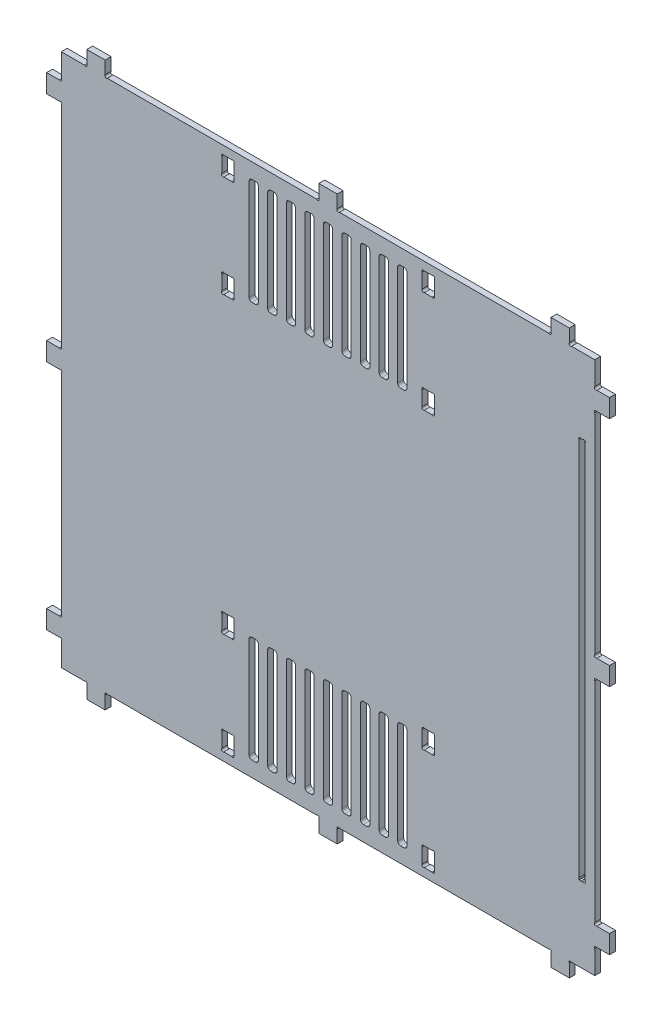
from build123d import *

# Parameters (mm, degrees)
BOSS_EXTRUDE1_DEPTH = 3.175
SKETCH2_W           = 3.302
SKETCH2_H           = 206.35
CUT_EXTRUDE1_DEPTH  = 418.540948216
SKETCH4_W           = 7.43030637
SKETCH4_H           = 0.0508
SKETCH4_W_2         = 0.0508
SKETCH4_H_2         = 7.253496569
SKETCH4_W_3         = 7.253496569
SKETCH4_H_3         = 7.43030637
CUT_EXTRUDE2_DEPTH  = 418.540948216
CUT_EXTRUDE4_DEPTH  = 418.540948216


# Read off the part's stored shape, not the designer's step: Boss-Extrude1
with BuildPart() as part:
    # Boss-Extrude1 outline → Boss-Extrude1 (new body)
    with BuildSketch(Plane.XY):
        with BuildLine():
            Line((13.65, 295.2375), (13.65, 288.422532015))
            ThreePointArc((13.65, 288.422532015), (13.65, 287.3), (12.527467985, 287.3))
            Line((12.527467985, 287.3), (0, 287.3))
            Line((0, 287.3), (0, 274.772532015))
            ThreePointArc((0, 274.772532015), (0, 273.65), (-1.122532015, 273.65))
            Line((-1.122532015, 273.65), (-7.9375, 273.65))
            Line((-7.9375, 273.65), (-7.9375, 263.65))
            Line((-7.9375, 263.65), (-1.122532015, 263.65))
            ThreePointArc((-1.122532015, 263.65), (0, 263.65), (0, 262.527467985))
            Line((0, 262.527467985), (0, 149.772532015))
            ThreePointArc((0, 149.772532015), (0, 148.65), (-1.122532015, 148.65))
            Line((-1.122532015, 148.65), (-7.9375, 148.65))
            Line((-7.9375, 148.65), (-7.9375, 138.65))
            Line((-7.9375, 138.65), (-1.122532015, 138.65))
            ThreePointArc((-1.122532015, 138.65), (0, 138.65), (0, 137.527467985))
            Line((0, 137.527467985), (0, 24.772532015))
            ThreePointArc((0, 24.772532015), (0, 23.65), (-1.122532015, 23.65))
            Line((-1.122532015, 23.65), (-7.9375, 23.65))
            Line((-7.9375, 23.65), (-7.9375, 13.65))
            Line((-7.9375, 13.65), (-1.122532015, 13.65))
            ThreePointArc((-1.122532015, 13.65), (0, 13.65), (0, 12.527467985))
            Line((0, 12.527467985), (0, 0))
            Line((0, 0), (12.527467985, 0))
            ThreePointArc((12.527467985, 0), (13.65, 0), (13.65, -1.122532015))
            Line((13.65, -1.122532015), (13.65, -7.9375))
            Line((13.65, -7.9375), (23.65, -7.9375))
            Line((23.65, -7.9375), (23.65, -1.122532015))
            ThreePointArc((23.65, -1.122532015), (23.65, 0), (24.772532015, 0))
            Line((24.772532015, 0), (137.527467985, 0))
            ThreePointArc((137.527467985, 0), (138.65, 0), (138.65, -1.122532015))
            Line((138.65, -1.122532015), (138.65, -7.9375))
            Line((138.65, -7.9375), (148.65, -7.9375))
            Line((148.65, -7.9375), (148.65, -1.122532015))
            ThreePointArc((148.65, -1.122532015), (148.65, 0), (149.772532015, 0))
            Line((149.772532015, 0), (262.527467985, 0))
            ThreePointArc((262.527467985, 0), (263.65, 0), (263.65, -1.122532015))
            Line((263.65, -1.122532015), (263.65, -7.9375))
            Line((263.65, -7.9375), (273.65, -7.9375))
            Line((273.65, -7.9375), (273.65, -1.122532015))
            ThreePointArc((273.65, -1.122532015), (273.65, 0), (274.772532015, 0))
            Line((274.772532015, 0), (287.3, 0))
            Line((287.3, 0), (287.3, 12.527467985))
            ThreePointArc((287.3, 12.527467985), (287.3, 13.65), (288.422532015, 13.65))
            Line((288.422532015, 13.65), (295.2375, 13.65))
            Line((295.2375, 13.65), (295.2375, 23.65))
            Line((295.2375, 23.65), (288.422532015, 23.65))
            ThreePointArc((288.422532015, 23.65), (287.3, 23.65), (287.3, 24.772532015))
            Line((287.3, 24.772532015), (287.3, 137.527467985))
            ThreePointArc((287.3, 137.527467985), (287.3, 138.65), (288.422532015, 138.65))
            Line((288.422532015, 138.65), (295.2375, 138.65))
            Line((295.2375, 138.65), (295.2375, 148.65))
            Line((295.2375, 148.65), (288.422532015, 148.65))
            ThreePointArc((288.422532015, 148.65), (287.3, 148.65), (287.3, 149.772532015))
            Line((287.3, 149.772532015), (287.3, 262.527467985))
            ThreePointArc((287.3, 262.527467985), (287.3, 263.65), (288.422532015, 263.65))
            Line((288.422532015, 263.65), (295.2375, 263.65))
            Line((295.2375, 263.65), (295.2375, 273.65))
            Line((295.2375, 273.65), (288.422532015, 273.65))
            ThreePointArc((288.422532015, 273.65), (287.3, 273.65), (287.3, 274.772532015))
            Line((287.3, 274.772532015), (287.3, 287.3))
            Line((287.3, 287.3), (274.772532015, 287.3))
            ThreePointArc((274.772532015, 287.3), (273.65, 287.3), (273.65, 288.422532015))
            Line((273.65, 288.422532015), (273.65, 295.2375))
            Line((273.65, 295.2375), (263.65, 295.2375))
            Line((263.65, 295.2375), (263.65, 288.422532015))
            ThreePointArc((263.65, 288.422532015), (263.65, 287.3), (262.527467985, 287.3))
            Line((262.527467985, 287.3), (149.772532015, 287.3))
            ThreePointArc((149.772532015, 287.3), (148.65, 287.3), (148.65, 288.422532015))
            Line((148.65, 288.422532015), (148.65, 295.2375))
            Line((148.65, 295.2375), (138.65, 295.2375))
            Line((138.65, 295.2375), (138.65, 288.422532015))
            ThreePointArc((138.65, 288.422532015), (138.65, 287.3), (137.527467985, 287.3))
            Line((137.527467985, 287.3), (24.772532015, 287.3))
            ThreePointArc((24.772532015, 287.3), (23.65, 287.3), (23.65, 288.422532015))
            Line((23.65, 288.422532015), (23.65, 295.2375))
            Line((23.65, 295.2375), (13.65, 295.2375))
        make_face()
        with BuildLine():
            Line((92.836997861, 13.451559456), (92.836997861, 5.696623486))
            ThreePointArc((92.836997861, 5.696623486), (92.836997861, 4.574091471), (91.714465846, 4.574091471))
            Line((91.714465846, 4.574091471), (87.609529876, 4.574091471))
            ThreePointArc((87.609529876, 4.574091471), (86.486997861, 4.574091471), (86.486997861, 5.696623486))
            Line((86.486997861, 5.696623486), (86.486997861, 13.451559456))
            ThreePointArc((86.486997861, 13.451559456), (86.486997861, 14.574091471), (87.609529876, 14.574091471))
            Line((87.609529876, 14.574091471), (91.714465846, 14.574091471))
            ThreePointArc((91.714465846, 14.574091471), (92.836997861, 14.574091471), (92.836997861, 13.451559456))
        make_face(mode=Mode.SUBTRACT)
        with BuildLine():
            Line((104.549498838, 8.25090853), (102.724498838, 8.25090853))
            ThreePointArc((102.724498838, 8.25090853), (101.601966823, 8.715876514), (101.136998838, 9.83840853))
            Line((101.136998838, 9.83840853), (101.136998838, 63.97740853))
            ThreePointArc((101.136998838, 63.97740853), (101.601966823, 65.099940546), (102.724498838, 65.56490853))
            Line((102.724498838, 65.56490853), (104.549498838, 65.56490853))
            ThreePointArc((104.549498838, 65.56490853), (105.672030853, 65.099940545), (106.136998838, 63.97740853))
            Line((106.136998838, 63.97740853), (106.136998838, 9.83840853))
            ThreePointArc((106.136998838, 9.83840853), (105.672030853, 8.715876515), (104.549498838, 8.25090853))
        make_face(mode=Mode.SUBTRACT)
        with BuildLine():
            Line((91.714465846, 59.438091471), (87.609529876, 59.438091471))
            ThreePointArc((87.609529876, 59.438091471), (86.486997861, 59.438091471), (86.486997861, 60.560623486))
            Line((86.486997861, 60.560623486), (86.486997861, 68.315559456))
            ThreePointArc((86.486997861, 68.315559456), (86.486997861, 69.438091471), (87.609529876, 69.438091471))
            Line((87.609529876, 69.438091471), (91.714465846, 69.438091471))
            ThreePointArc((91.714465846, 69.438091471), (92.836997861, 69.438091471), (92.836997861, 68.315559456))
            Line((92.836997861, 68.315559456), (92.836997861, 60.560623486))
            ThreePointArc((92.836997861, 60.560623486), (92.836997861, 59.438091471), (91.714465846, 59.438091471))
        make_face(mode=Mode.SUBTRACT)
        with BuildLine():
            Line((114.549498838, 8.25090853), (112.724498838, 8.25090853))
            ThreePointArc((112.724498838, 8.25090853), (111.601966823, 8.715876514), (111.136998838, 9.83840853))
            Line((111.136998838, 9.83840853), (111.136998838, 63.97740853))
            ThreePointArc((111.136998838, 63.97740853), (111.601966823, 65.099940546), (112.724498838, 65.56490853))
            Line((112.724498838, 65.56490853), (114.549498838, 65.56490853))
            ThreePointArc((114.549498838, 65.56490853), (115.672030853, 65.099940545), (116.136998838, 63.97740853))
            Line((116.136998838, 63.97740853), (116.136998838, 9.83840853))
            ThreePointArc((116.136998838, 9.83840853), (115.672030853, 8.715876515), (114.549498838, 8.25090853))
        make_face(mode=Mode.SUBTRACT)
        with BuildLine():
            Line((124.549498838, 8.25090853), (122.724498838, 8.25090853))
            ThreePointArc((122.724498838, 8.25090853), (121.601966823, 8.715876514), (121.136998838, 9.83840853))
            Line((121.136998838, 9.83840853), (121.136998838, 63.97740853))
            ThreePointArc((121.136998838, 63.97740853), (121.601966823, 65.099940546), (122.724498838, 65.56490853))
            Line((122.724498838, 65.56490853), (124.549498838, 65.56490853))
            ThreePointArc((124.549498838, 65.56490853), (125.672030853, 65.099940545), (126.136998838, 63.97740853))
            Line((126.136998838, 63.97740853), (126.136998838, 9.83840853))
            ThreePointArc((126.136998838, 9.83840853), (125.672030853, 8.715876515), (124.549498838, 8.25090853))
        make_face(mode=Mode.SUBTRACT)
        with BuildLine():
            Line((131.136998838, 9.83840853), (131.136998838, 63.97740853))
            ThreePointArc((131.136998838, 63.97740853), (131.601966823, 65.099940545), (132.724498838, 65.56490853))
            Line((132.724498838, 65.56490853), (134.549498838, 65.56490853))
            ThreePointArc((134.549498838, 65.56490853), (135.672030853, 65.099940545), (136.136998838, 63.97740853))
            Line((136.136998838, 63.97740853), (136.136998838, 9.83840853))
            ThreePointArc((136.136998838, 9.83840853), (135.672030853, 8.715876515), (134.549498838, 8.25090853))
            Line((134.549498838, 8.25090853), (132.724498838, 8.25090853))
            ThreePointArc((132.724498838, 8.25090853), (131.601966823, 8.715876515), (131.136998838, 9.83840853))
        make_face(mode=Mode.SUBTRACT)
        with BuildLine():
            Line((144.549498838, 8.25090853), (142.724498838, 8.25090853))
            ThreePointArc((142.724498838, 8.25090853), (141.601966823, 8.715876515), (141.136998838, 9.83840853))
            Line((141.136998838, 9.83840853), (141.136998838, 63.97740853))
            ThreePointArc((141.136998838, 63.97740853), (141.601966823, 65.099940545), (142.724498838, 65.56490853))
            Line((142.724498838, 65.56490853), (144.549498838, 65.56490853))
            ThreePointArc((144.549498838, 65.56490853), (145.672030853, 65.099940545), (146.136998838, 63.97740853))
            Line((146.136998838, 63.97740853), (146.136998838, 9.83840853))
            ThreePointArc((146.136998838, 9.83840853), (145.672030853, 8.715876515), (144.549498838, 8.25090853))
        make_face(mode=Mode.SUBTRACT)
        with BuildLine():
            Line((194.436999814, 5.666542396), (194.436999814, 13.421478365))
            ThreePointArc((194.436999814, 13.421478365), (194.436999814, 14.54401038), (195.559531829, 14.54401038))
            Line((195.559531829, 14.54401038), (199.664467799, 14.54401038))
            ThreePointArc((199.664467799, 14.54401038), (200.786999814, 14.54401038), (200.786999814, 13.421478365))
            Line((200.786999814, 13.421478365), (200.786999814, 5.666542396))
            ThreePointArc((200.786999814, 5.666542396), (200.786999814, 4.54401038), (199.664467799, 4.54401038))
            Line((199.664467799, 4.54401038), (195.559531829, 4.54401038))
            ThreePointArc((195.559531829, 4.54401038), (194.436999814, 4.54401038), (194.436999814, 5.666542396))
        make_face(mode=Mode.SUBTRACT)
        with BuildLine():
            Line((151.136998838, 9.83840853), (151.136998838, 63.97740853))
            ThreePointArc((151.136998838, 63.97740853), (151.601966823, 65.099940545), (152.724498838, 65.56490853))
            Line((152.724498838, 65.56490853), (154.549498838, 65.56490853))
            ThreePointArc((154.549498838, 65.56490853), (155.672030853, 65.099940545), (156.136998838, 63.97740853))
            Line((156.136998838, 63.97740853), (156.136998838, 9.83840853))
            ThreePointArc((156.136998838, 9.83840853), (155.672030853, 8.715876515), (154.549498838, 8.25090853))
            Line((154.549498838, 8.25090853), (152.724498838, 8.25090853))
            ThreePointArc((152.724498838, 8.25090853), (151.601966823, 8.715876515), (151.136998838, 9.83840853))
        make_face(mode=Mode.SUBTRACT)
        with BuildLine():
            Line((164.549498838, 8.25090853), (162.724498838, 8.25090853))
            ThreePointArc((162.724498838, 8.25090853), (161.601966823, 8.715876515), (161.136998838, 9.83840853))
            Line((161.136998838, 9.83840853), (161.136998838, 63.97740853))
            ThreePointArc((161.136998838, 63.97740853), (161.602585269, 65.100558652), (162.726247588, 65.564907567))
            Line((162.726247588, 65.564907567), (164.549497999, 65.56490853))
            ThreePointArc((164.549497999, 65.56490853), (165.672030556, 65.099940842), (166.136998838, 63.97740853))
            Line((166.136998838, 63.97740853), (166.136998838, 9.83840853))
            ThreePointArc((166.136998838, 9.83840853), (165.672030853, 8.715876515), (164.549498838, 8.25090853))
        make_face(mode=Mode.SUBTRACT)
        with BuildLine():
            Line((171.136998838, 9.83840853), (171.136998838, 63.97740853))
            ThreePointArc((171.136998838, 63.97740853), (171.601966823, 65.099940545), (172.724498838, 65.56490853))
            Line((172.724498838, 65.56490853), (174.549498838, 65.56490853))
            ThreePointArc((174.549498838, 65.56490853), (175.672030853, 65.099940545), (176.136998838, 63.97740853))
            Line((176.136998838, 63.97740853), (176.136998838, 9.83840853))
            ThreePointArc((176.136998838, 9.83840853), (175.672030853, 8.715876515), (174.549498838, 8.25090853))
            Line((174.549498838, 8.25090853), (172.724498838, 8.25090853))
            ThreePointArc((172.724498838, 8.25090853), (171.601966823, 8.715876515), (171.136998838, 9.83840853))
        make_face(mode=Mode.SUBTRACT)
        with BuildLine():
            Line((184.549498838, 8.25090853), (182.724498838, 8.25090853))
            ThreePointArc((182.724498838, 8.25090853), (181.601966823, 8.715876515), (181.136998838, 9.83840853))
            Line((181.136998838, 9.83840853), (181.136998838, 63.97740853))
            ThreePointArc((181.136998838, 63.97740853), (181.601966823, 65.099940545), (182.724498838, 65.56490853))
            Line((182.724498838, 65.56490853), (184.549498838, 65.56490853))
            ThreePointArc((184.549498838, 65.56490853), (185.672030853, 65.099940545), (186.136998838, 63.97740853))
            Line((186.136998838, 63.97740853), (186.136998838, 9.83840853))
            ThreePointArc((186.136998838, 9.83840853), (185.672030853, 8.715876515), (184.549498838, 8.25090853))
        make_face(mode=Mode.SUBTRACT)
        with BuildLine():
            Line((195.559531829, 69.40801038), (199.664467799, 69.40801038))
            ThreePointArc((199.664467799, 69.40801038), (200.786999814, 69.40801038), (200.786999814, 68.285478365))
            Line((200.786999814, 68.285478365), (200.786999814, 60.530542396))
            ThreePointArc((200.786999814, 60.530542396), (200.786999814, 59.40801038), (199.664467799, 59.40801038))
            Line((199.664467799, 59.40801038), (195.559531829, 59.40801038))
            ThreePointArc((195.559531829, 59.40801038), (194.436999814, 59.40801038), (194.436999814, 60.530542396))
            Line((194.436999814, 60.530542396), (194.436999814, 68.285478365))
            ThreePointArc((194.436999814, 68.285478365), (194.436999814, 69.40801038), (195.559531829, 69.40801038))
        make_face(mode=Mode.SUBTRACT)
        with BuildLine():
            Line((280.930799481, 40.475), (280.000863511, 40.475))
            ThreePointArc((280.000863511, 40.475), (278.878331496, 40.475), (278.878331496, 41.597532015))
            Line((278.878331496, 41.597532015), (278.878331496, 245.702467985))
            ThreePointArc((278.878331496, 245.702467985), (278.878331496, 246.825), (280.000863511, 246.825))
            Line((280.000863511, 246.825), (280.930799481, 246.825))
            ThreePointArc((280.930799481, 246.825), (282.053331496, 246.825), (282.053331496, 245.702467985))
            Line((282.053331496, 245.702467985), (282.053331496, 41.597532015))
            ThreePointArc((282.053331496, 41.597532015), (282.053331496, 40.475), (280.930799481, 40.475))
        make_face(mode=Mode.SUBTRACT)
        with BuildLine():
            Line((86.486997861, 218.984440544), (86.486997861, 226.739376514))
            ThreePointArc((86.486997861, 226.739376514), (86.486997861, 227.861908529), (87.609529876, 227.861908529))
            Line((87.609529876, 227.861908529), (91.714465846, 227.861908529))
            ThreePointArc((91.714465846, 227.861908529), (92.836997861, 227.861908529), (92.836997861, 226.739376514))
            Line((92.836997861, 226.739376514), (92.836997861, 218.984440544))
            ThreePointArc((92.836997861, 218.984440544), (92.836997861, 217.861908529), (91.714465846, 217.861908529))
            Line((91.714465846, 217.861908529), (87.609529876, 217.861908529))
            ThreePointArc((87.609529876, 217.861908529), (86.486997861, 217.861908529), (86.486997861, 218.984440544))
        make_face(mode=Mode.SUBTRACT)
        with BuildLine():
            Line((101.136998838, 223.32259147), (101.136998838, 277.461591202))
            ThreePointArc((101.136998838, 277.461591202), (101.601966806, 278.584123312), (102.724498838, 279.04909147))
            Line((102.724498838, 279.04909147), (104.549498838, 279.04909147))
            ThreePointArc((104.549498838, 279.04909147), (105.672030853, 278.584123485), (106.136998838, 277.46159147))
            Line((106.136998838, 277.46159147), (106.136998838, 223.32259147))
            ThreePointArc((106.136998838, 223.32259147), (105.672030853, 222.200059455), (104.549498838, 221.73509147))
            Line((104.549498838, 221.73509147), (102.724498838, 221.73509147))
            ThreePointArc((102.724498838, 221.73509147), (101.601966823, 222.200059454), (101.136998838, 223.32259147))
        make_face(mode=Mode.SUBTRACT)
        with BuildLine():
            Line((111.136998838, 223.32259147), (111.136998838, 277.46159147))
            ThreePointArc((111.136998838, 277.46159147), (111.601966822, 278.584123486), (112.724498838, 279.04909147))
            Line((112.724498838, 279.04909147), (114.549498838, 279.04909147))
            ThreePointArc((114.549498838, 279.04909147), (115.672030853, 278.584123485), (116.136998838, 277.46159147))
            Line((116.136998838, 277.46159147), (116.136998838, 223.32259147))
            ThreePointArc((116.136998838, 223.32259147), (115.672030853, 222.200059455), (114.549498838, 221.73509147))
            Line((114.549498838, 221.73509147), (112.724498838, 221.73509147))
            ThreePointArc((112.724498838, 221.73509147), (111.601966823, 222.200059454), (111.136998838, 223.32259147))
        make_face(mode=Mode.SUBTRACT)
        with BuildLine():
            Line((121.136998838, 223.32259147), (121.136998838, 277.46159147))
            ThreePointArc((121.136998838, 277.46159147), (121.601966822, 278.584123486), (122.724498838, 279.04909147))
            Line((122.724498838, 279.04909147), (124.549498838, 279.04909147))
            ThreePointArc((124.549498838, 279.04909147), (125.672030853, 278.584123485), (126.136998838, 277.46159147))
            Line((126.136998838, 277.46159147), (126.136998838, 223.32259147))
            ThreePointArc((126.136998838, 223.32259147), (125.672030853, 222.200059455), (124.549498838, 221.73509147))
            Line((124.549498838, 221.73509147), (122.724498838, 221.73509147))
            ThreePointArc((122.724498838, 221.73509147), (121.601966823, 222.200059454), (121.136998838, 223.32259147))
        make_face(mode=Mode.SUBTRACT)
        with BuildLine():
            Line((134.549498838, 221.73509147), (132.724498838, 221.73509147))
            ThreePointArc((132.724498838, 221.73509147), (131.601966823, 222.200059455), (131.136998838, 223.32259147))
            Line((131.136998838, 223.32259147), (131.136998838, 277.46159147))
            ThreePointArc((131.136998838, 277.46159147), (131.601966822, 278.584123486), (132.724498838, 279.04909147))
            Line((132.724498838, 279.04909147), (134.549498838, 279.04909147))
            ThreePointArc((134.549498838, 279.04909147), (135.672030853, 278.584123485), (136.136998838, 277.46159147))
            Line((136.136998838, 277.46159147), (136.136998838, 223.32259147))
            ThreePointArc((136.136998838, 223.32259147), (135.672030853, 222.200059455), (134.549498838, 221.73509147))
        make_face(mode=Mode.SUBTRACT)
        with BuildLine():
            Line((141.136998838, 223.32259147), (141.136998838, 277.46159147))
            ThreePointArc((141.136998838, 277.46159147), (141.601966822, 278.584123486), (142.724498838, 279.04909147))
            Line((142.724498838, 279.04909147), (144.549498838, 279.04909147))
            ThreePointArc((144.549498838, 279.04909147), (145.672030853, 278.584123485), (146.136998838, 277.46159147))
            Line((146.136998838, 277.46159147), (146.136998838, 223.32259147))
            ThreePointArc((146.136998838, 223.32259147), (145.672030853, 222.200059455), (144.549498838, 221.73509147))
            Line((144.549498838, 221.73509147), (142.724498838, 221.73509147))
            ThreePointArc((142.724498838, 221.73509147), (141.601966823, 222.200059455), (141.136998838, 223.32259147))
        make_face(mode=Mode.SUBTRACT)
        with BuildLine():
            Line((87.609529876, 282.725908529), (91.714465846, 282.725908529))
            ThreePointArc((91.714465846, 282.725908529), (92.836997861, 282.725908529), (92.836997861, 281.603376514))
            Line((92.836997861, 281.603376514), (92.836997861, 273.848440544))
            ThreePointArc((92.836997861, 273.848440544), (92.836997861, 272.725908529), (91.714465846, 272.725908529))
            Line((91.714465846, 272.725908529), (87.609529876, 272.725908529))
            ThreePointArc((87.609529876, 272.725908529), (86.486997861, 272.725908529), (86.486997861, 273.848440544))
            Line((86.486997861, 273.848440544), (86.486997861, 281.603376514))
            ThreePointArc((86.486997861, 281.603376514), (86.486997861, 282.725908529), (87.609529876, 282.725908529))
        make_face(mode=Mode.SUBTRACT)
        with BuildLine():
            Line((154.549498838, 221.73509147), (152.724498838, 221.73509147))
            ThreePointArc((152.724498838, 221.73509147), (151.601966823, 222.200059455), (151.136998838, 223.32259147))
            Line((151.136998838, 223.32259147), (151.136998838, 277.46159147))
            ThreePointArc((151.136998838, 277.46159147), (151.601966822, 278.584123486), (152.724498838, 279.04909147))
            Line((152.724498838, 279.04909147), (154.549498838, 279.04909147))
            ThreePointArc((154.549498838, 279.04909147), (155.672030853, 278.584123485), (156.136998838, 277.46159147))
            Line((156.136998838, 277.46159147), (156.136998838, 223.32259147))
            ThreePointArc((156.136998838, 223.32259147), (155.672030853, 222.200059455), (154.549498838, 221.73509147))
        make_face(mode=Mode.SUBTRACT)
        with BuildLine():
            Line((161.136998838, 223.32259147), (161.136998838, 277.461591202))
            ThreePointArc((161.136998838, 277.461591202), (161.601966806, 278.584123312), (162.724498838, 279.04909147))
            Line((162.724498838, 279.04909147), (164.549498838, 279.04909147))
            ThreePointArc((164.549498838, 279.04909147), (165.672030712, 278.584123144), (166.136998356, 277.461590988))
            Line((166.136998356, 277.461590988), (166.136998356, 223.322590988))
            ThreePointArc((166.136998356, 223.322590988), (165.672030372, 222.200058972), (164.549498356, 221.735090988))
            Line((164.549498356, 221.735090988), (162.724497517, 221.735091952))
            ThreePointArc((162.724497517, 221.735091952), (161.601966385, 222.200060092), (161.136998838, 223.32259147))
        make_face(mode=Mode.SUBTRACT)
        with BuildLine():
            Line((174.549498838, 221.73509147), (172.724498838, 221.73509147))
            ThreePointArc((172.724498838, 221.73509147), (171.601966823, 222.200059455), (171.136998838, 223.32259147))
            Line((171.136998838, 223.32259147), (171.136998838, 277.46159147))
            ThreePointArc((171.136998838, 277.46159147), (171.601966822, 278.584123486), (172.724498838, 279.04909147))
            Line((172.724498838, 279.04909147), (174.549498838, 279.04909147))
            ThreePointArc((174.549498838, 279.04909147), (175.672030853, 278.584123485), (176.136998838, 277.46159147))
            Line((176.136998838, 277.46159147), (176.136998838, 223.32259147))
            ThreePointArc((176.136998838, 223.32259147), (175.672030853, 222.200059455), (174.549498838, 221.73509147))
        make_face(mode=Mode.SUBTRACT)
        with BuildLine():
            Line((200.786999814, 226.769457604), (200.786999814, 219.014521635))
            ThreePointArc((200.786999814, 219.014521635), (200.786999814, 217.89198962), (199.664467799, 217.89198962))
            Line((199.664467799, 217.89198962), (195.559531829, 217.89198962))
            ThreePointArc((195.559531829, 217.89198962), (194.436999814, 217.89198962), (194.436999814, 219.014521635))
            Line((194.436999814, 219.014521635), (194.436999814, 226.769457604))
            ThreePointArc((194.436999814, 226.769457604), (194.436999813, 227.89198962), (195.559531829, 227.89198962))
            Line((195.559531829, 227.89198962), (199.664467799, 227.89198962))
            ThreePointArc((199.664467799, 227.89198962), (200.786999815, 227.89198962), (200.786999814, 226.769457604))
        make_face(mode=Mode.SUBTRACT)
        with BuildLine():
            Line((181.136998838, 223.32259147), (181.136998838, 277.46159147))
            ThreePointArc((181.136998838, 277.46159147), (181.601966822, 278.584123486), (182.724498838, 279.04909147))
            Line((182.724498838, 279.04909147), (184.549498838, 279.04909147))
            ThreePointArc((184.549498838, 279.04909147), (185.672030853, 278.584123485), (186.136998838, 277.46159147))
            Line((186.136998838, 277.46159147), (186.136998838, 223.32259147))
            ThreePointArc((186.136998838, 223.32259147), (185.672030853, 222.200059455), (184.549498838, 221.73509147))
            Line((184.549498838, 221.73509147), (182.724498838, 221.73509147))
            ThreePointArc((182.724498838, 221.73509147), (181.601966823, 222.200059455), (181.136998838, 223.32259147))
        make_face(mode=Mode.SUBTRACT)
        with BuildLine():
            Line((199.664467799, 272.75598962), (195.559531829, 272.75598962))
            ThreePointArc((195.559531829, 272.75598962), (194.436999814, 272.75598962), (194.436999814, 273.878521635))
            Line((194.436999814, 273.878521635), (194.436999814, 281.633457604))
            ThreePointArc((194.436999814, 281.633457604), (194.436999814, 282.755989619), (195.559531829, 282.75598962))
            Line((195.559531829, 282.75598962), (199.664467799, 282.75598962))
            ThreePointArc((199.664467799, 282.75598962), (200.786999814, 282.755989619), (200.786999814, 281.633457604))
            Line((200.786999814, 281.633457604), (200.786999814, 273.878521635))
            ThreePointArc((200.786999814, 273.878521635), (200.786999814, 272.75598962), (199.664467799, 272.75598962))
        make_face(mode=Mode.SUBTRACT)
    extrude(amount=BOSS_EXTRUDE1_DEPTH)

    # Sketch2 → Cut-Extrude1 (cut, through all)
    with BuildSketch(Plane.XY.offset(3.175)):
        with Locations((280.465831496, 143.65)):
            Rectangle(SKETCH2_W, SKETCH2_H)
    extrude(amount=-CUT_EXTRUDE1_DEPTH, mode=Mode.SUBTRACT)

    # Sketch4 → Cut-Extrude2 (cut, through all)
    with BuildSketch(Plane.XY.offset(3.175)):
        with Locations((-4.222346815, 148.6246)):
            Rectangle(SKETCH4_W, SKETCH4_H)
        with Locations((23.6246, 291.610751715)):
            Rectangle(SKETCH4_W_2, SKETCH4_H_2)
        with Locations((13.6754, 291.610751715)):
            Rectangle(SKETCH4_W_2, SKETCH4_H_2)
        with Locations((-4.222346815, 273.6246)):
            Rectangle(SKETCH4_W, SKETCH4_H)
        with Locations((-4.222346815, 263.6754)):
            Rectangle(SKETCH4_W, SKETCH4_H)
        with Locations((-4.222346815, 138.6754)):
            Rectangle(SKETCH4_W, SKETCH4_H)
        with Locations((-4.222346815, 23.6246)):
            Rectangle(SKETCH4_W, SKETCH4_H)
        with Locations((-4.222346815, 13.6754)):
            Rectangle(SKETCH4_W, SKETCH4_H)
        with Locations((148.6246, 291.610751715)):
            Rectangle(SKETCH4_W_2, SKETCH4_H_2)
        with Locations((138.6754, 291.610751715)):
            Rectangle(SKETCH4_W_2, SKETCH4_H_2)
        with Locations((273.6246, 291.610751715)):
            Rectangle(SKETCH4_W_2, SKETCH4_H_2)
        with Locations((263.6754, 291.610751715)):
            Rectangle(SKETCH4_W_2, SKETCH4_H_2)
        with Locations((291.610751715, 263.6754)):
            Rectangle(SKETCH4_W_3, SKETCH4_H)
        with Locations((291.610751715, 273.6246)):
            Rectangle(SKETCH4_W_3, SKETCH4_H)
        with Locations((291.610751715, 138.6754)):
            Rectangle(SKETCH4_W_3, SKETCH4_H)
        with Locations((291.610751715, 148.6246)):
            Rectangle(SKETCH4_W_3, SKETCH4_H)
        with Locations((291.610751715, 13.6754)):
            Rectangle(SKETCH4_W_3, SKETCH4_H)
        with Locations((291.610751715, 23.6246)):
            Rectangle(SKETCH4_W_3, SKETCH4_H)
        with Locations((13.6754, -4.222346815)):
            Rectangle(SKETCH4_W_2, SKETCH4_H_3)
        with Locations((23.6246, -4.222346815)):
            Rectangle(SKETCH4_W_2, SKETCH4_H_3)
        with Locations((138.6754, -4.222346815)):
            Rectangle(SKETCH4_W_2, SKETCH4_H_3)
        with Locations((148.6246, -4.222346815)):
            Rectangle(SKETCH4_W_2, SKETCH4_H_3)
        with Locations((263.6754, -4.222346815)):
            Rectangle(SKETCH4_W_2, SKETCH4_H_3)
        with Locations((273.6246, -4.222346815)):
            Rectangle(SKETCH4_W_2, SKETCH4_H_3)
    extrude(amount=-CUT_EXTRUDE2_DEPTH, mode=Mode.SUBTRACT)

    # Sketch6 → Cut-Extrude4 (cut, through all)
    with BuildSketch(Plane.XY.offset(3.175)):
        with BuildLine():
            Line((86.575319737, 272.649708529), (92.748675985, 272.649708529))
            ThreePointArc((92.748675985, 272.649708529), (92.836997861, 272.725908529), (92.913197861, 272.814230405))
            Line((92.913197861, 272.814230405), (92.913197861, 282.637586653))
            ThreePointArc((92.913197861, 282.637586653), (92.836997861, 282.725908529), (92.748675985, 282.802108529))
            Line((92.748675985, 282.802108529), (86.575319737, 282.802108529))
            ThreePointArc((86.575319737, 282.802108529), (86.486997861, 282.725908529), (86.410797861, 282.637586653))
            Line((86.410797861, 282.637586653), (86.410797861, 272.814230405))
            ThreePointArc((86.410797861, 272.814230405), (86.486997861, 272.725908529), (86.575319737, 272.649708529))
        make_face()
    cut_extrude4 = extrude(amount=-CUT_EXTRUDE4_DEPTH, mode=Mode.SUBTRACT)

    # Sketch-Pattern1: Cut-Extrude4 at 7 more places
    with Locations((0, -213.287817, 0), (0, -268.151817, 0), (107.950002, -268.181898, 0), (107.950002, -213.317898, 0), (0, -54.864, 0), (107.950002, -54.833919, 0), (107.950002, 0.030081, 0)):
        add(cut_extrude4, mode=Mode.SUBTRACT)


solid = part.part
